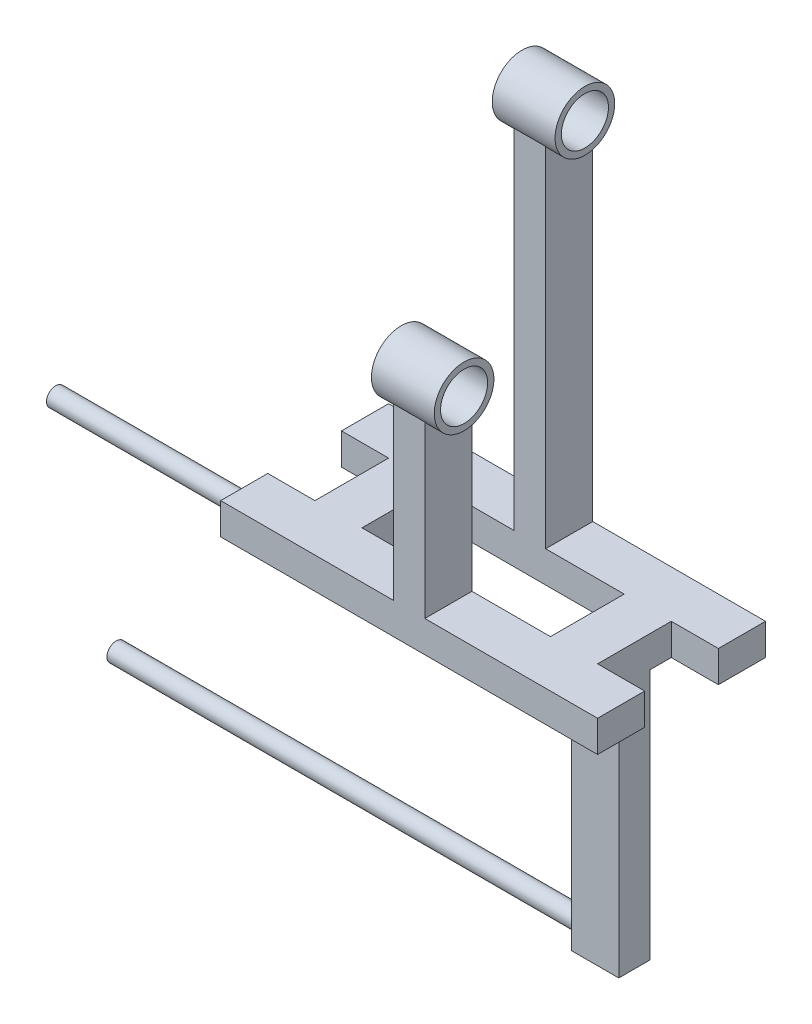
from build123d import *

# Parameters (mm, degrees)
SKETCH2_W               = 60
SKETCH2_H               = 23.4666089
BOSS_EXTRUDE2_DEPTH     = 10
SKETCH3_W               = 10
SKETCH3_H               = 15
BOSS_EXTRUDE3_DEPTH     = 60
SKETCH4_W               = 10
SKETCH4_H               = 15
BOSS_EXTRUDE4_DEPTH     = 56.7502592
SKETCH6_R               = 9.5
SKETCH6_R_2             = 7.5
EXTRUDE_THIN1_DEPTH     = 10
CUT_EXTRUDE1_DEPTH      = 157.290369402
CUT_EXTRUDE1_DEPTH_BACK = 157.290369402
SKETCH8_W               = 15
SKETCH8_H               = 10
BOSS_EXTRUDE5_DEPTH     = 80
SKETCH9_R               = 2.95
BOSS_EXTRUDE6_DEPTH     = 150
SKETCH10_R              = 2.95
BOSS_EXTRUDE7_DEPTH     = 60


with BuildPart() as part:
    # Sketch2 → Boss-Extrude2 (new body)
    with BuildSketch(Plane(origin=(0, 0, 0), x_dir=(1, 0, 0), z_dir=(0, 1, 0))):
        Polygon((60, -15), (-60, -15), (-60, 0), (-45, 0), (-45, 23.4666089), (-60, 23.4666089), (-60, 38.4666089), (60, 38.4666089), (60, 23.4666089), (45, 23.4666089), (45, 0), (60, 0), align=None)
        with Locations((0, 11.73330445)):
            Rectangle(SKETCH2_W, SKETCH2_H, mode=Mode.SUBTRACT)
    extrude(amount=BOSS_EXTRUDE2_DEPTH)

    # Sketch3 → Boss-Extrude3 (add)
    with BuildSketch(Plane(origin=(0, 10, 0), x_dir=(1, 0, 0), z_dir=(0, 1, 0))):
        with Locations((0, -7.5)):
            Rectangle(SKETCH3_W, SKETCH3_H)
        with Locations((0, 30.9666089)):
            Rectangle(SKETCH3_W, SKETCH3_H)
    extrude(amount=BOSS_EXTRUDE3_DEPTH)

    # Sketch4 → Boss-Extrude4 (add)
    with BuildSketch(Plane(origin=(0, 70, 0), x_dir=(1, 0, 0), z_dir=(0, 1, 0))):
        with Locations((0, 30.9666089)):
            Rectangle(SKETCH4_W, SKETCH4_H)
    extrude(amount=BOSS_EXTRUDE4_DEPTH)

    # Sketch6 → Extrude-Thin1 (add, symmetric)
    # profile 1 of 2: a face of its own
    with BuildSketch(Plane(origin=(0, 0, 0), x_dir=(0, 0, -1), z_dir=(1, 0, 0))):
        with Locations((-7.5, 70)):
            Circle(SKETCH6_R)
        with Locations((-7.5, 70)):
            Circle(SKETCH6_R_2, mode=Mode.SUBTRACT)
    # profile 2 of 2: a face of its own
    with BuildSketch(Plane(origin=(0, 0, 0), x_dir=(0, 0, -1), z_dir=(1, 0, 0))):
        with Locations((30.9666089, 126.7502592)):
            Circle(SKETCH6_R)
        with Locations((30.9666089, 126.7502592)):
            Circle(SKETCH6_R_2, mode=Mode.SUBTRACT)
    extrude(amount=EXTRUDE_THIN1_DEPTH, both=True)

    # Sketch7 → Cut-Extrude1 (cut, two sides: drawn at the far end of the back side and taken through both)
    with BuildSketch(Plane(origin=(5, 0, 0), x_dir=(0, 0, -1), z_dir=(1, 0, 0)).offset(-CUT_EXTRUDE1_DEPTH_BACK)):
        with BuildLine():
            Line((0, 70), (-15, 70))
            ThreePointArc((-15, 70), (-7.5, 62.5), (0, 70))
        make_face()
        with BuildLine():
            Line((38.4666089, 126.7502592), (23.4666089, 126.7502592))
            ThreePointArc((23.4666089, 126.7502592), (30.9666089, 119.2502592), (38.4666089, 126.7502592))
        make_face()
    extrude(amount=CUT_EXTRUDE1_DEPTH + CUT_EXTRUDE1_DEPTH_BACK, mode=Mode.SUBTRACT)

    # Sketch8 → Boss-Extrude5 (add)
    with BuildSketch(Plane.XZ):
        with Locations((37.5, -11.75)):
            Rectangle(SKETCH8_W, SKETCH8_H)
    extrude(amount=BOSS_EXTRUDE5_DEPTH)

    # Sketch9 → Boss-Extrude6 (add)
    with BuildSketch(Plane.ZY.offset(-30)):
        with Locations((-11.75, -75)):
            Circle(SKETCH9_R)
    extrude(amount=BOSS_EXTRUDE6_DEPTH)

    # Sketch10 → Boss-Extrude7 (add)
    with BuildSketch(Plane.ZY.offset(60)):
        with Locations((7.5, 5)):
            Circle(SKETCH10_R)
    extrude(amount=BOSS_EXTRUDE7_DEPTH)


solid = part.part
